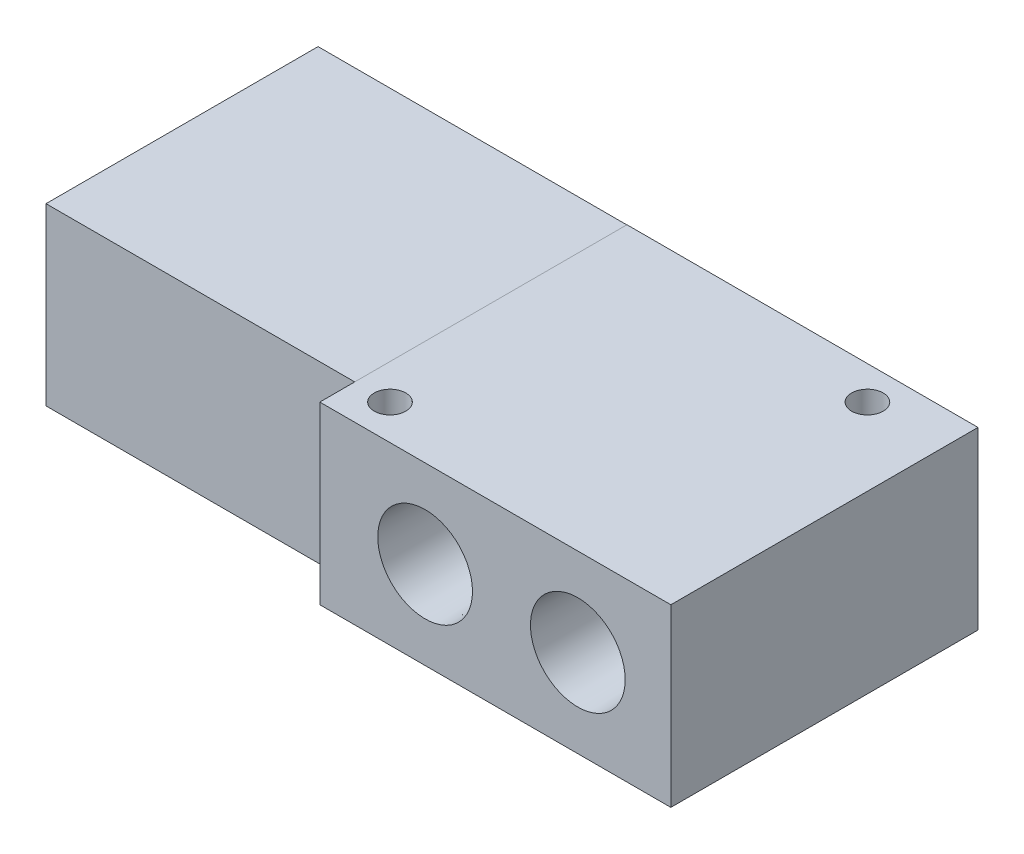
from build123d import *

# Parameters (mm, degrees)
BOSS_EXTRUDE1_DEPTH = 25.4
SKETCH2_W           = 44.704
SKETCH2_H           = 0.0254
CUT_EXTRUDE1_DEPTH  = 107.377492525
SKETCH3_R           = 2.286
CUT_EXTRUDE2_DEPTH  = 107.377492525


# Read off the part's stored shape, not the designer's step: 1/4 NPT Tapped Hole1
with BuildPart() as part:
    # Sketch1 → Boss-Extrude1 (new body)
    with BuildSketch(Plane(origin=(0, 0, 0), x_dir=(1, 0, 0), z_dir=(0, 1, 0))):
        Polygon((44.704, -5.08), (95.504, -5.08), (95.504, 39.37), (0, 39.37), (0, 0), (44.704, 0), align=None)
    extrude(amount=BOSS_EXTRUDE1_DEPTH)

    # Sketch2 → Cut-Extrude1 (cut, through all)
    with BuildSketch(Plane.XY):
        with Locations((22.352, 25.3873)):
            Rectangle(SKETCH2_W, SKETCH2_H)
        with Locations((22.352, 0.0127)):
            Rectangle(SKETCH2_W, SKETCH2_H)
    extrude(amount=-CUT_EXTRUDE1_DEPTH, mode=Mode.SUBTRACT)

    # Sketch3 → Cut-Extrude2 (cut, through all)
    with BuildSketch(Plane(origin=(0, 25.4, 0), x_dir=(1, 0, 0), z_dir=(0, 1, 0))):
        with Locations(Location((49.784, 0, 0), (0, 0, 270))):
            Circle(SKETCH3_R)
        with Locations(Location((84.328, 34.544, 0), (0, 0, 270))):
            Circle(SKETCH3_R)
    extrude(amount=-CUT_EXTRUDE2_DEPTH, mode=Mode.SUBTRACT)

    # 1/4 NPT Tapped Hole1 outline → 1/4 NPT Tapped Hole1 (revolve, cut)
    with BuildSketch(Plane(origin=(69.85, 12.7, 0), x_dir=(1, 0, 0), z_dir=(0, -1, 0))):
        Polygon((5.5626, -22.352), (0, -19.009652721), (0, -39.37), (6.8545837, -39.37), (6.557984794, -29.464), (5.5626, -29.464), align=None)
    revolve(axis=Axis((69.85, 12.7, 0), (0, 0, 1)), mode=Mode.SUBTRACT)

    # 1_4 NPT Tapped Hole1 2 outline → 1_4 NPT Tapped Hole1 2 (revolve, cut)
    with BuildSketch(Plane(origin=(82.042, 12.7, 0), x_dir=(1, 0, 0), z_dir=(0, -1, 0))):
        Polygon((0, 5.08), (0, -15.280347279), (5.5626, -11.938), (5.5626, -4.826), (6.557984794, -4.826), (6.8545837, 5.08), align=None)
    revolve(axis=Axis((82.042, 12.7, 0), (0, 0, 1)), mode=Mode.SUBTRACT)

    # 1_4 NPT Tapped Hole1 3 outline → 1_4 NPT Tapped Hole1 3 (revolve, cut)
    with BuildSketch(Plane(origin=(59.944, 12.7, 0), x_dir=(1, 0, 0), z_dir=(0, -1, 0))):
        Polygon((6.8545837, 5.08), (0, 5.08), (0, -15.280347279), (5.5626, -11.938), (5.5626, -4.826), (6.557984794, -4.826), align=None)
    revolve(axis=Axis((59.944, 12.7, 0), (0, 0, 1)), mode=Mode.SUBTRACT)


solid = part.part
